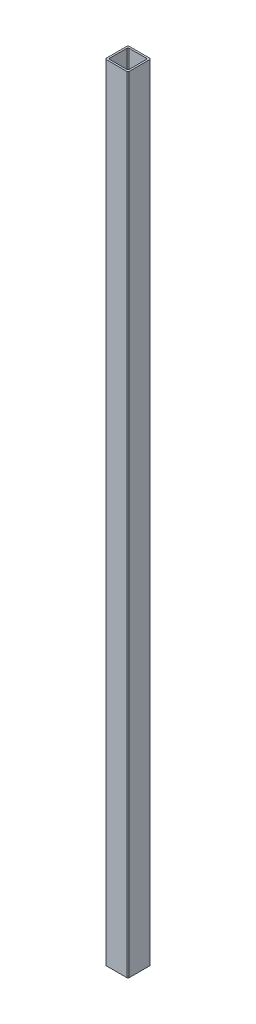
from build123d import *

# Parameters (mm, degrees)
BOSS_EXTRUDE1_DEPTH = 685


with BuildPart() as part:
    # Sketch1 → Boss-Extrude1 (new body)
    with BuildSketch(Plane(origin=(0, 0, 0), x_dir=(1, 0, 0), z_dir=(0, 1, 0))):
        with BuildLine():
            Line((-9, -10), (9, -10))
            ThreePointArc((9, -10), (9.707106781, -9.707106781), (10, -9))
            Line((10, -9), (10, 9))
            ThreePointArc((10, 9), (9.707106781, 9.707106781), (9, 10))
            Line((9, 10), (-9, 10))
            ThreePointArc((-9, 10), (-9.707106781, 9.707106781), (-10, 9))
            Line((-10, 9), (-10, -9))
            ThreePointArc((-10, -9), (-9.707106781, -9.707106781), (-9, -10))
        make_face()
        with BuildLine():
            Line((-7.5, -8.5), (7.5, -8.5))
            ThreePointArc((7.5, -8.5), (8.207106781, -8.207106781), (8.5, -7.5))
            Line((8.5, -7.5), (8.5, 7.5))
            ThreePointArc((8.5, 7.5), (8.207106781, 8.207106781), (7.5, 8.5))
            Line((7.5, 8.5), (-7.5, 8.5))
            ThreePointArc((-7.5, 8.5), (-8.207106781, 8.207106781), (-8.5, 7.5))
            Line((-8.5, 7.5), (-8.5, -7.5))
            ThreePointArc((-8.5, -7.5), (-8.207106781, -8.207106781), (-7.5, -8.5))
        make_face(mode=Mode.SUBTRACT)
    extrude(amount=BOSS_EXTRUDE1_DEPTH)


solid = part.part
